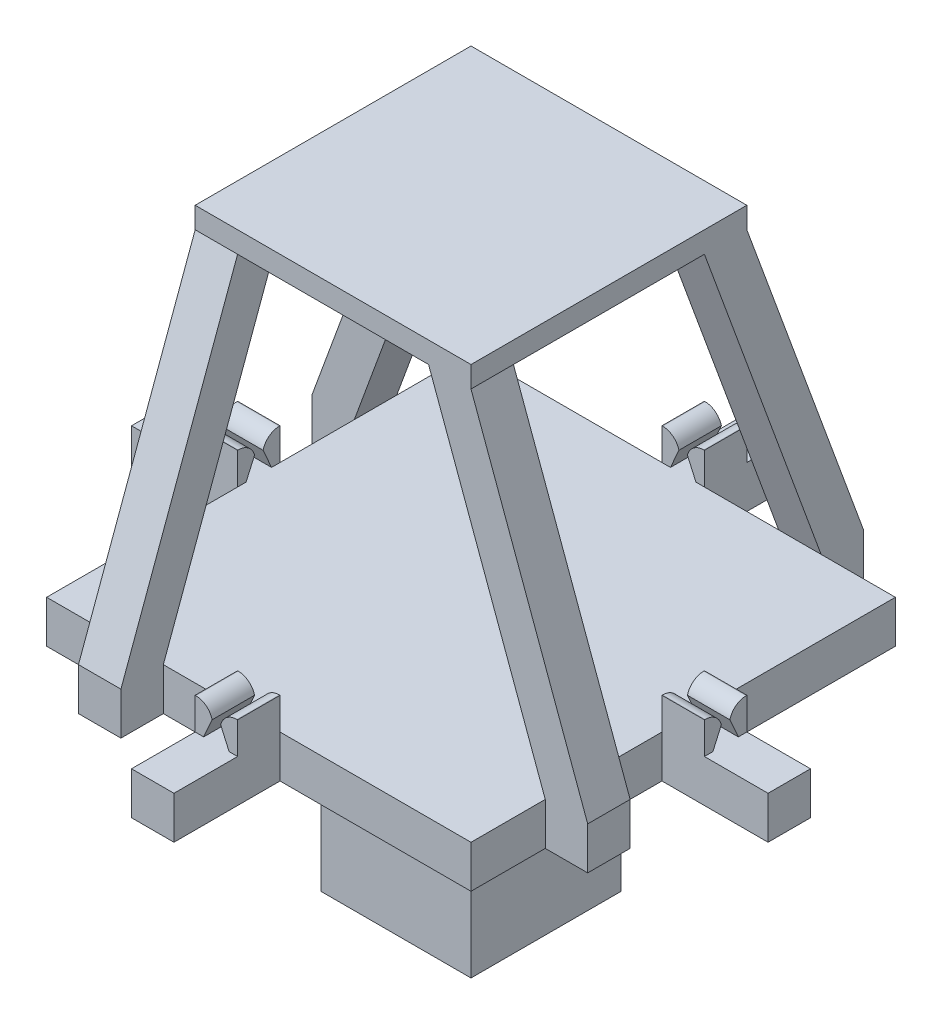
from build123d import *

# Parameters (mm, degrees)
SKETCH2_W            = 100
SKETCH2_H            = 100
BOSS_EXTRUDE1_DEPTH  = 5
SKETCH3_W            = 100
SKETCH3_H            = 100
BOSS_EXTRUDE2_DEPTH  = 5
SKETCH8_R            = 5
BOSS_EXTRUDE7_DEPTH  = 30
SKETCH9_W            = 35.4
SKETCH9_H            = 35.4
BOSS_EXTRUDE8_DEPTH  = 20
SKETCH10_W           = 25.4
SKETCH10_H           = 25.4
CUT_EXTRUDE1_DEPTH   = 12.7
BOSS_EXTRUDE21_DEPTH = 10
FILLET14_R           = 4
FILLET13_R           = 4
SKETCH24_W           = 10
SKETCH24_H           = 10
BOSS_EXTRUDE22_DEPTH = 15
BOSS_EXTRUDE25_DEPTH = 10
SKETCH26_W           = 10
SKETCH26_H           = 10
BOSS_EXTRUDE26_DEPTH = 15
FILLET18_R           = 4
FILLET17_R           = 4
BOSS_EXTRUDE23_DEPTH = 10
SKETCH25_W           = 10
SKETCH25_H           = 10
BOSS_EXTRUDE24_DEPTH = 15
FILLET15_R           = 4
FILLET16_R           = 4
BOSS_EXTRUDE10_DEPTH = 10
FILLET19_R           = 4
SKETCH27_W           = 10
SKETCH27_H           = 10
BOSS_EXTRUDE27_DEPTH = 15
FILLET20_R           = 4
SKETCH33_W           = 65
SKETCH33_H           = 65
BOSS_EXTRUDE29_DEPTH = 5
BOSS_EXTRUDE28_DEPTH = 10
BOSS_EXTRUDE32_DEPTH = 10
BOSS_EXTRUDE31_DEPTH = 10
BOSS_EXTRUDE33_DEPTH = 10
BOSS_EXTRUDE34_DEPTH = 10
BOSS_EXTRUDE35_DEPTH = 10
BOSS_EXTRUDE36_DEPTH = 10
BOSS_EXTRUDE37_DEPTH = 10


with BuildPart() as part:
    # Sketch2 → Boss-Extrude1 (new body)
    with BuildSketch(Plane(origin=(0, 0, 0), x_dir=(1, 0, 0), z_dir=(0, 1, 0))):
        Rectangle(SKETCH2_W, SKETCH2_H)
    extrude(amount=BOSS_EXTRUDE1_DEPTH)

    # Sketch3 → Boss-Extrude2 (add)
    with BuildSketch(Plane.XZ):
        Rectangle(SKETCH3_W, SKETCH3_H)
    extrude(amount=BOSS_EXTRUDE2_DEPTH)

    # Sketch8 → Boss-Extrude7 (add)
    with BuildSketch(Plane.XZ.offset(5)):
        with Locations(Location((0, 0, 0), (0, 0, 90))):
            Circle(SKETCH8_R)
    extrude(amount=BOSS_EXTRUDE7_DEPTH)

    # Sketch9 → Boss-Extrude8 (add)
    with BuildSketch(Plane.XZ.offset(35)):
        Rectangle(SKETCH9_W, SKETCH9_H)
    extrude(amount=BOSS_EXTRUDE8_DEPTH)

    # Sketch10 → Cut-Extrude1 (cut)
    with BuildSketch(Plane.XZ.offset(55)):
        Rectangle(SKETCH10_W, SKETCH10_H)
    extrude(amount=-CUT_EXTRUDE1_DEPTH, mode=Mode.SUBTRACT)

    # Sketch11 → Boss-Extrude21 (add)
    with BuildSketch(Plane(origin=(50, 0, 0), x_dir=(0, 0, -1), z_dir=(1, 0, 0))):
        Polygon((5, -5), (5, 12.5), (1, 12.5), (1, 9.5), (3, 5), (-3, 5), (-1, 9.5), (-1, 12.5), (-5, 12.5), (-5, -5), align=None)
    extrude(amount=BOSS_EXTRUDE21_DEPTH)

    # Fillet14
    # the kernel refuses this fillet: 4 mm, written as the material it takes off along each edge
    with BuildSketch(Plane(origin=(40.317541634, 12.5, -1), x_dir=(0, 0, -1), z_dir=(1, 0, 0))) as fillet14_piece_1:
        with BuildLine():
            CenterArc((3.872983346, -4), FILLET14_R, 90, 75.522487814)
            Line((0, -3), (-0.077459667, -2.98))
            ThreePointArc((-0.077459667, -2.98), (-0.08, -1.5), (-0.08, 0))
            Line((-0.08, 0), (0, 0.08))
            Line((0, 0.08), (3.872983346, 0.08))
            Line((3.872983346, 0.08), (3.872983346, 0))
        make_face()
    extrude(amount=29.364916731, mode=Mode.SUBTRACT)

    # Fillet13
    # the kernel refuses this fillet: 4 mm, written as the material it takes off along each edge
    with BuildSketch(Plane(origin=(40.317541634, 12.5, 1), x_dir=(0, 0, 1), z_dir=(1, 0, 0))) as fillet13_piece_1:
        with BuildLine():
            CenterArc((3.872983346, 4), FILLET13_R, 194.477512186, 75.522487814)
            Line((0, 3), (-0.077459667, 2.98))
            ThreePointArc((-0.077459667, 2.98), (-0.08, 1.5), (-0.08, 0))
            Line((-0.08, 0), (0, -0.08))
            Line((0, -0.08), (3.872983346, -0.08))
            Line((3.872983346, -0.08), (3.872983346, 0))
        make_face()
    extrude(amount=29.364916731, mode=Mode.SUBTRACT)

    # Sketch24 → Boss-Extrude22 (add)
    with BuildSketch(Plane(origin=(60, 0, 0), x_dir=(0, 0, -1), z_dir=(1, 0, 0))):
        Rectangle(SKETCH24_W, SKETCH24_H)
    extrude(amount=BOSS_EXTRUDE22_DEPTH)

    # Sketch13 → Boss-Extrude25 (add)
    with BuildSketch(Plane.ZY.offset(50)):
        Polygon((-5, 12.5), (-5, -5), (5, -5), (5, 12.5), (1, 12.5), (1, 9.5), (3, 5), (-3, 5), (-1, 9.5), (-1, 12.5), align=None)
    extrude(amount=BOSS_EXTRUDE25_DEPTH)

    # Sketch26 → Boss-Extrude26 (add)
    with BuildSketch(Plane.ZY.offset(60)):
        Rectangle(SKETCH26_W, SKETCH26_H)
    extrude(amount=BOSS_EXTRUDE26_DEPTH)

    # Fillet18
    # the kernel refuses this fillet: 4 mm, written as the material it takes off along each edge
    with BuildSketch(Plane(origin=(-40.317541634, 12.5, 1), x_dir=(0, 0, 1), z_dir=(-1, 0, 0))) as fillet18_piece_1:
        with BuildLine():
            CenterArc((3.872983346, -4), FILLET18_R, 90, 75.522487814)
            Line((0, -3), (-0.077459667, -2.98))
            ThreePointArc((-0.077459667, -2.98), (-0.08, -1.5), (-0.08, 0))
            Line((-0.08, 0), (0, 0.08))
            Line((0, 0.08), (3.872983346, 0.08))
            Line((3.872983346, 0.08), (3.872983346, 0))
        make_face()
    extrude(amount=29.364916731, mode=Mode.SUBTRACT)

    # Fillet17
    # the kernel refuses this fillet: 4 mm, written as the material it takes off along each edge
    with BuildSketch(Plane(origin=(-40.317541634, 12.5, -1), x_dir=(0, 0, -1), z_dir=(-1, 0, 0))) as fillet17_piece_1:
        with BuildLine():
            CenterArc((3.872983346, 4), FILLET17_R, 194.477512186, 75.522487814)
            Line((0, 3), (-0.077459667, 2.98))
            ThreePointArc((-0.077459667, 2.98), (-0.08, 1.5), (-0.08, 0))
            Line((-0.08, 0), (0, -0.08))
            Line((0, -0.08), (3.872983346, -0.08))
            Line((3.872983346, -0.08), (3.872983346, 0))
        make_face()
    extrude(amount=29.364916731, mode=Mode.SUBTRACT)

    # Sketch14 → Boss-Extrude23 (add)
    with BuildSketch(Plane(origin=(0, 0, -50), x_dir=(-1, 0, 0), z_dir=(0, 0, -1))):
        Polygon((-5, 12.5), (-1, 12.5), (-1, 9.5), (-3, 5), (3, 5), (1, 9.5), (1, 12.5), (5, 12.5), (5, -5), (-5, -5), align=None)
    extrude(amount=BOSS_EXTRUDE23_DEPTH)

    # Sketch25 → Boss-Extrude24 (add)
    with BuildSketch(Plane(origin=(0, 0, -60), x_dir=(-1, 0, 0), z_dir=(0, 0, -1))):
        Rectangle(SKETCH25_W, SKETCH25_H)
    extrude(amount=BOSS_EXTRUDE24_DEPTH)

    # Fillet15
    # the kernel refuses this fillet: 4 mm, written as the material it takes off along each edge
    with BuildSketch(Plane(origin=(-1, 12.5, -40.317541634), x_dir=(0, -1, 0), z_dir=(0, 0, -1))) as fillet15_piece_1:
        with BuildLine():
            CenterArc((4, 3.872983346), FILLET15_R, 180, 75.522487814)
            Line((0, 3.872983346), (-0.08, 3.872983346))
            Line((-0.08, 3.872983346), (-0.08, 0))
            Line((-0.08, 0), (0, -0.08))
            ThreePointArc((0, -0.08), (1.5, -0.08), (2.98, -0.077459667))
            Line((2.98, -0.077459667), (3, 0))
        make_face()
    extrude(amount=29.364916731, mode=Mode.SUBTRACT)

    # Fillet16
    # the kernel refuses this fillet: 4 mm, written as the material it takes off along each edge
    with BuildSketch(Plane(origin=(1, 12.5, -40.317541634), x_dir=(1, 0, 0), z_dir=(0, 0, -1))) as fillet16_piece_1:
        with BuildLine():
            CenterArc((3.872983346, 4), FILLET16_R, 194.477512186, 75.522487814)
            Line((0, 3), (-0.077459667, 2.98))
            ThreePointArc((-0.077459667, 2.98), (-0.08, 1.5), (-0.08, 0))
            Line((-0.08, 0), (0, -0.08))
            Line((0, -0.08), (3.872983346, -0.08))
            Line((3.872983346, -0.08), (3.872983346, 0))
        make_face()
    extrude(amount=29.364916731, mode=Mode.SUBTRACT)

    # Sketch12 → Boss-Extrude10 (add)
    with BuildSketch(Plane.XY.offset(50)):
        Polygon((-5, 12.5), (-5, -5), (5, -5), (5, 12.5), (1, 12.5), (1, 9.5), (3, 5), (-3, 5), (-1, 9.5), (-1, 12.5), align=None)
    extrude(amount=BOSS_EXTRUDE10_DEPTH)

    # Fillet19
    # the kernel refuses this fillet: 4 mm, written as the material it takes off along each edge
    with BuildSketch(Plane(origin=(-1, 12.5, 40.317541634), x_dir=(-1, 0, 0), z_dir=(0, 0, 1))) as fillet19_piece_1:
        with BuildLine():
            CenterArc((3.872983346, 4), FILLET19_R, 194.477512186, 75.522487814)
            Line((0, 3), (-0.077459667, 2.98))
            ThreePointArc((-0.077459667, 2.98), (-0.08, 1.5), (-0.08, 0))
            Line((-0.08, 0), (0, -0.08))
            Line((0, -0.08), (3.872983346, -0.08))
            Line((3.872983346, -0.08), (3.872983346, 0))
        make_face()
    extrude(amount=29.364916731, mode=Mode.SUBTRACT)

    # Sketch27 → Boss-Extrude27 (add)
    with BuildSketch(Plane.XY.offset(60)):
        Rectangle(SKETCH27_W, SKETCH27_H)
    extrude(amount=BOSS_EXTRUDE27_DEPTH)

    # Fillet20
    # the kernel refuses this fillet: 4 mm, written as the material it takes off along each edge
    with BuildSketch(Plane(origin=(1, 12.5, 40.317541634), x_dir=(1, 0, 0), z_dir=(0, 0, 1))) as fillet20_piece_1:
        with BuildLine():
            CenterArc((3.872983346, -4), FILLET20_R, 90, 75.522487814)
            Line((0, -3), (-0.077459667, -2.98))
            ThreePointArc((-0.077459667, -2.98), (-0.08, -1.5), (-0.08, 0))
            Line((-0.08, 0), (0, 0.08))
            Line((0, 0.08), (3.872983346, 0.08))
            Line((3.872983346, 0.08), (3.872983346, 0))
        make_face()
    extrude(amount=29.364916731, mode=Mode.SUBTRACT)

    # Sketch30 → Boss-Extrude28 (add)
    with BuildSketch(Plane.ZY.offset(50)):
        Polygon((-27.5, 5), (-22.5, 5), (-22.5, -5), (-32.5, -5), (-32.5, 5), align=None)
    extrude(amount=BOSS_EXTRUDE28_DEPTH)



with BuildPart() as body_2:
    # Sketch33 → Boss-Extrude29 (new body)
    with BuildSketch(Plane(origin=(0, 85, 0), x_dir=(1, 0, 0), z_dir=(0, 1, 0))):
        Rectangle(SKETCH33_W, SKETCH33_H)
    extrude(amount=-BOSS_EXTRUDE29_DEPTH)


with BuildPart() as part_1:
    add(part.part)

    add(body_2.part)  # Boss-Extrude32 merges body 2
    # Sketch40 → Boss-Extrude32 (add)
    with BuildSketch(Plane(origin=(0, 0, -32.5), x_dir=(-1, 0, 0), z_dir=(0, 0, -1))):
        Polygon((60, 5), (32.5, 80), (22.5, 80), (50, 5), align=None)
    extrude(amount=-BOSS_EXTRUDE32_DEPTH)

    # Sketch37 → Boss-Extrude31 (add)
    with BuildSketch(Plane.XY.offset(50)):
        Polygon((-27.5, 5), (-22.5, 5), (-22.5, -5), (-32.5, -5), (-32.5, 5), align=None)
    extrude(amount=BOSS_EXTRUDE31_DEPTH)

    # Sketch41 → Boss-Extrude33 (add)
    with BuildSketch(Plane.ZY.offset(32.5)):
        Polygon((60, 5), (32.5, 80), (22.5, 80), (50, 5), align=None)
    extrude(amount=-BOSS_EXTRUDE33_DEPTH)

    # Sketch42 → Boss-Extrude34 (add)
    with BuildSketch(Plane(origin=(50, 0, 0), x_dir=(0, 0, -1), z_dir=(1, 0, 0))):
        Polygon((-27.5, 5), (-22.5, 5), (-22.5, -5), (-32.5, -5), (-32.5, 5), align=None)
    extrude(amount=BOSS_EXTRUDE34_DEPTH)

    # Sketch43 → Boss-Extrude35 (add)
    with BuildSketch(Plane.XY.offset(32.5)):
        Polygon((32.5, 80), (60, 5), (50, 5), (22.5, 80), align=None)
    extrude(amount=-BOSS_EXTRUDE35_DEPTH)

    # Sketch44 → Boss-Extrude36 (add)
    with BuildSketch(Plane(origin=(0, 0, -50), x_dir=(-1, 0, 0), z_dir=(0, 0, -1))):
        Polygon((-27.5, 5), (-22.5, 5), (-22.5, -5), (-32.5, -5), (-32.5, 5), align=None)
    extrude(amount=BOSS_EXTRUDE36_DEPTH)

    # Sketch45 → Boss-Extrude37 (add)
    with BuildSketch(Plane(origin=(32.5, 0, 0), x_dir=(0, 0, -1), z_dir=(1, 0, 0))):
        Polygon((32.5, 80), (60, 5), (50, 5), (22.5, 80), align=None)
    extrude(amount=-BOSS_EXTRUDE37_DEPTH)


solid = part_1.part
